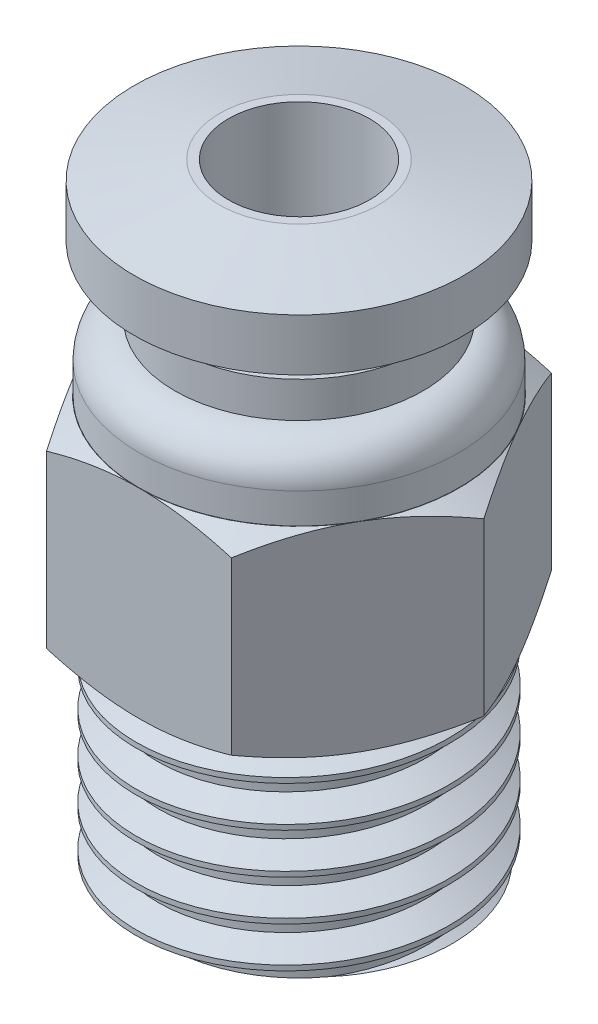
from build123d import *

# Parameters (mm, degrees)
FILLET_1_R               = 1.1
CHAMFER_1_SIZE           = 0.76
CHAMFER_1_SIZE2          = 0.438786205
CHAMFER_3_SIZE2          = 1.55
CHAMFER_3_SIZE           = 0.9
CUT_EXTRUDE_1_DEPTH      = 2
CUT_EXTRUDE_1_DEPTH_BACK = 7
SKETCH_3_R               = 6.18085144
THREAD_1_PITCH           = 1.25
THREAD_1_TO              = 7
CHAMFER_4_SIZE           = 0.2
CHAMFER_4_SIZE2          = 0.115470054


with BuildPart() as part:
    # Sketch 1 → 旋转1 (revolve)
    with BuildSketch(Plane.XY, mode=Mode.PRIVATE) as revolve_1_sk:
        Polygon((-3.25, -7.6125), (-3.25, -4.0125), (-2.17, -3.245192308), (-2.17, 11.2875), (-2.445, 11.2875), (-5.07, 10.722115385), (-5.07, 9.122115385), (-2.620769231, 9.122115385), (-2.620769231, 8.122115385), (-3.82, 8.122115385), (-3.82, 7.022115385), (-4.92, 7.022115385), (-4.92, 4.9875), (-5.69, 4.9875), (-5.69, -1.6125), (-4.14, -1.6125), (-4.14, -7.6125), align=None)
    revolve(revolve_1_sk.sketch.rotate(Axis((0, 0, 0), (0, 1, 0)), 270), axis=Axis((0, 0, 0), (0, 1, 0)))

    # 圆角1
    fillet_1_edges = [part.edges().sort_by_distance(p)[0] for p in [
        (0, 7.022115385, 4.92),
    ]]
    fillet(fillet_1_edges, radius=FILLET_1_R - 0.0001)  # a hair under: the kernel refuses the full size

    # 倒角1
    chamfer_1_edges = [part.edges().sort_by_distance(p)[0] for p in [
        (0, 4.9875, 5.69),
    ]]
    chamfer_1_side = [part.faces().sort_by_distance(p)[0] for p in [
        (0, 4.9875, 5.080937503),
    ]]
    chamfer(chamfer_1_edges, length=CHAMFER_1_SIZE, length2=CHAMFER_1_SIZE2, reference=chamfer_1_side[0])

    # 倒角3
    chamfer_3_edges = [part.edges().sort_by_distance(p)[0] for p in [
        (0, -1.6125, 5.69),
    ]]
    chamfer_3_side = [part.faces().sort_by_distance(p)[0] for p in [
        (0, -1.5945, 5.69),
    ]]
    chamfer(chamfer_3_edges, length=CHAMFER_3_SIZE - 0.0001, length2=CHAMFER_3_SIZE2 - 0.0001, reference=chamfer_3_side[0])  # a hair under: the kernel refuses the full size

    # 草图3 → 切除-拉伸1 (cut, two sides: drawn at the far end of the back side and taken through both)
    with BuildSketch(Plane(origin=(0, 4.548713795, 0), x_dir=(1, 0, 0), z_dir=(0, 1, 0)).offset(-CUT_EXTRUDE_1_DEPTH_BACK)):
        Circle(SKETCH_3_R)
        Polygon((-5.69, 0), (-2.845, -4.927684548), (2.845, -4.927684548), (5.69, 0), (2.845, 4.927684548), (-2.845, 4.927684548), align=None, mode=Mode.SUBTRACT)
    extrude(amount=CUT_EXTRUDE_1_DEPTH + CUT_EXTRUDE_1_DEPTH_BACK, mode=Mode.SUBTRACT)

    # 螺纹线1: arcs per turn and ends read off the stored shape
    # 螺纹线1: the profile of Sketch 1 2 profile screwed along a right-hand helix through 6.4 turns, 8 arcs to a turn; built about Z, then put on its axis
    thread_1_z = Axis((0, 0, 0), (0, 0, 1))
    thread_1_corners = [(4.1397, 0, -0.000173205), (4.816582344, 0, 0.390624998), (4.816582344, 0, 0.546874998), (4.1397, 0, 0.937673202)]
    with BuildLine(mode=Mode.PRIVATE) as thread_1_profile:
        Line(thread_1_corners[0], thread_1_corners[1])
        Line(thread_1_corners[1], thread_1_corners[2])
        Line(thread_1_corners[2], thread_1_corners[3])
        Line(thread_1_corners[3], thread_1_corners[0])
    thread_1_cap = Face(thread_1_profile.wire())
    thread_1_turn_angles = [0, 22.5, 45, 67.5, 90, 112.5, 135, 157.5, 180, 202.5, 225, 247.5, 270, 292.5, 315, 337.5, 360]
    thread_1_turn_weights = [1, 0.9238795325112867, 1, 0.9238795325112867, 1, 0.9238795325112867, 1, 0.9238795325112867, 1, 0.9238795325112867, 1, 0.9238795325112867, 1, 0.9238795325112867, 1, 0.9238795325112867, 1]
    thread_1_turn_rails = [Edge.make_bspline([Vector(p[0], p[1], 0).rotate(thread_1_z, thread_1_turn_angles[k]) / thread_1_turn_weights[k] + Vector(0, 0, p[2] + THREAD_1_PITCH * thread_1_turn_angles[k] / 360) for k in range(17)], [0, 0, 0, 1, 1, 2, 2, 3, 3, 4, 4, 5, 5, 6, 6, 7, 7, 8, 8, 8], 2, thread_1_turn_weights) for p in thread_1_corners]
    thread_1_turn_sides = [Face.make_surface_from_curves(thread_1_turn_rails[p[0]], thread_1_turn_rails[p[1]]) for p in [(0, 1), (1, 2), (2, 3), (3, 0)]]
    thread_1_last_angles = [2160, 2182.5, 2205, 2227.5, 2250, 2272.5, 2295, 2299.5, 2304]
    thread_1_last_weights = [1, 0.9238795325112867, 1, 0.9238795325112867, 1, 0.9238795325112867, 1, 0.996917333733128, 1]
    thread_1_last_rails = [Edge.make_bspline([Vector(p[0], p[1], 0).rotate(thread_1_z, thread_1_last_angles[k]) / thread_1_last_weights[k] + Vector(0, 0, p[2] + THREAD_1_PITCH * thread_1_last_angles[k] / 360) for k in range(9)], [0, 0, 0, 1, 1, 2, 2, 3, 3, 4, 4, 4], 2, thread_1_last_weights) for p in thread_1_corners]
    thread_1_last_sides = [Face.make_surface_from_curves(thread_1_last_rails[p[0]], thread_1_last_rails[p[1]]) for p in [(0, 1), (1, 2), (2, 3), (3, 0)]]
    thread_1 = Plane(origin=(0, -0.6125, 0), x_dir=(-1, 0, 0), z_dir=(0, -1, 0)) * split(Solid(Shell([*[p.moved(Location((0, 0, THREAD_1_PITCH * i))) for i in range(6) for p in thread_1_turn_sides], *thread_1_last_sides, thread_1_cap, thread_1_cap.rotate(thread_1_z, 2304).moved(Location((0, 0, THREAD_1_PITCH * 2304 / 360)))])), bisect_by=Plane.XY.offset(THREAD_1_TO), keep=Keep.BOTTOM, mode=Mode.PRIVATE)
    add(thread_1)

    # 倒角4
    chamfer_4_edges = [part.edges().sort_by_distance(p)[0] for p in [
        (0, -7.6125, 3.25),
    ]]
    chamfer_4_side = [part.faces().sort_by_distance(p)[0] for p in [
        (-3.741085984, -7.6125, 1.861718516),
    ]]
    chamfer(chamfer_4_edges, length=CHAMFER_4_SIZE, length2=CHAMFER_4_SIZE2, reference=chamfer_4_side[0])


solid = part.part
